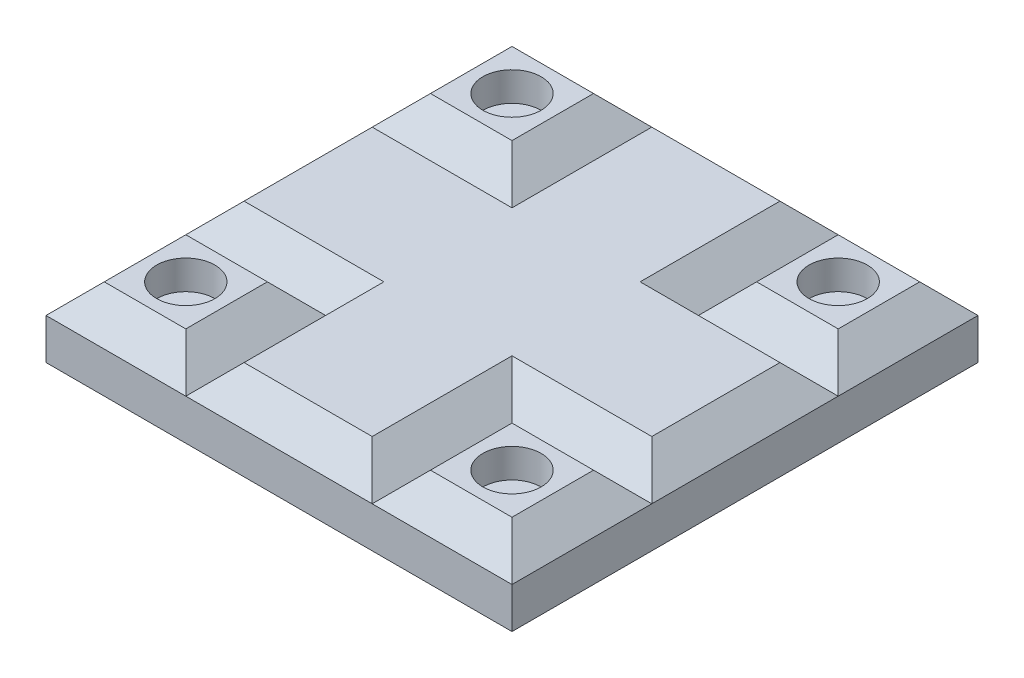
from build123d import *

# Parameters (mm, degrees)
SKETCH1_W               = 40
SKETCH1_H               = 40
BOSS_EXTRUDE1_DEPTH     = 6
SKETCH2_W               = 12
SKETCH2_H               = 12
CUT_EXTRUDE1_DEPTH      = 2.5
CHAMFER1_SIZE           = 2.5
SKETCH3_W               = 12
SKETCH3_H               = 12
BOSS_EXTRUDE2_DEPTH     = 2.5
CHAMFER2_SIZE           = 2.5
CIRPATTERN1_OUTLINE_W   = 7
CIRPATTERN1_OUTLINE_H   = 7
CIRPATTERN1_DEPTH       = 2.5
CIRPATTERN1_DRAFT       = 45
CIRPATTERN1_2_OUTLINE_W = 7
CIRPATTERN1_2_OUTLINE_H = 7
CIRPATTERN1_2_DEPTH     = 2.5
CIRPATTERN1_2_DRAFT     = 45
CIRPATTERN1_3_OUTLINE_W = 7
CIRPATTERN1_3_OUTLINE_H = 7
CIRPATTERN1_3_DEPTH     = 2.5
CIRPATTERN1_3_DRAFT     = 45
SKETCH4_R               = 2.5
CUT_EXTRUDE2_DEPTH      = 2.5
CIRPATTERN2_COUNT       = 4


# Read off the part's stored shape, not the designer's step: CirPattern1
# Some blends are built 0.0001 mm under size
with BuildPart() as part:
    # Sketch1 → Boss-Extrude1 (new body)
    with BuildSketch(Plane(origin=(0, 0, 0), x_dir=(1, 0, 0), z_dir=(0, 1, 0))):
        Rectangle(SKETCH1_W, SKETCH1_H)
    extrude(amount=BOSS_EXTRUDE1_DEPTH)

    # Sketch2 → Cut-Extrude1 (cut)
    with BuildSketch(Plane(origin=(0, 6, 0), x_dir=(1, 0, 0), z_dir=(0, 1, 0))):
        with Locations((14, 14)):
            Rectangle(SKETCH2_W, SKETCH2_H)
        with Locations((-14, 14)):
            Rectangle(SKETCH2_W, SKETCH2_H)
        with Locations((14, -14)):
            Rectangle(SKETCH2_W, SKETCH2_H)
        with Locations((-14, -14)):
            Rectangle(SKETCH2_W, SKETCH2_H)
    extrude(amount=-CUT_EXTRUDE1_DEPTH, mode=Mode.SUBTRACT)

    # Chamfer1
    chamfer1_edges = [part.edges().sort_by_distance(p)[0] for p in [
        (-20, 6, 0),
        (-14, 6, -8),
        (-8, 6, -14),
        (0, 6, -20),
        (8, 6, -14),
        (14, 6, -8),
        (20, 6, 0),
        (14, 6, 8),
        (8, 6, 14),
        (0, 6, 20),
        (-8, 6, 14),
        (-14, 6, 8),
    ]]
    chamfer(chamfer1_edges, length=CHAMFER1_SIZE - 0.0001)  # a hair under: the kernel refuses the full size

    # Sketch3 → Boss-Extrude2 (add)
    with BuildSketch(Plane(origin=(0, 3.5, 0), x_dir=(1, 0, 0), z_dir=(0, 1, 0))):
        with Locations((-14, -14)):
            Rectangle(SKETCH3_W, SKETCH3_H)
    extrude(amount=BOSS_EXTRUDE2_DEPTH)

    # Chamfer2
    # the kernel refuses this chamfer: 2.5 mm, written as the material it takes off along each edge
    with BuildSketch(Plane(origin=(-26.42920747, 6, 8), x_dir=(0, -0.9996219169112968, -0.027495876610586317), z_dir=(1, 0, 0)), Plane(origin=(-8, 6, 8), x_dir=(0.027495876610586317, -0.9996219169112968, 0), z_dir=(0, 0, 1))) as chamfer2_piece_1:
        Polygon((CHAMFER2_SIZE * 0.999621916911, -CHAMFER2_SIZE * 0.0274958766106), (-CHAMFER2_SIZE * 0.0274958766106, -CHAMFER2_SIZE * 0.999621916911), (0, 0), align=None)
    extrude(amount=18.42920747, mode=Mode.SUBTRACT)
    with BuildSketch(Plane(origin=(-1.57079253, 6, 20), x_dir=(0, -0.9996219169112968, 0.027495876610586317), z_dir=(-1, 0, 0))) as chamfer2_piece_2:
        Polygon((CHAMFER2_SIZE * 0.999621916911, -CHAMFER2_SIZE * 0.0274958766106), (-CHAMFER2_SIZE * 0.0274958766106, -CHAMFER2_SIZE * 0.999621916911), (0, 0), align=None)
    extrude(amount=24.85841494, mode=Mode.SUBTRACT)
    with BuildSketch(Plane(origin=(-20, 6, 26.42920747), x_dir=(0.9996219169112968, 0.027495876610586317, 0), z_dir=(0, 0, -1))) as chamfer2_piece_3:
        Polygon((CHAMFER2_SIZE * 0.999621916911, CHAMFER2_SIZE * 0.0274958766106), (-CHAMFER2_SIZE * 0.0274958766106, CHAMFER2_SIZE * 0.999621916911), (0, 0), align=None)
    extrude(amount=24.85841494, mode=Mode.SUBTRACT)


with BuildPart() as cirpattern1_tool:
    # CirPattern1 outline → CirPattern1 (with draft: the straight prism first)
    with BuildSketch(Plane(origin=(0, 6, 0), x_dir=(1, 0, 0), z_dir=(0, 1, 0))):
        with Locations((14, -14)):
            Rectangle(CIRPATTERN1_OUTLINE_W, CIRPATTERN1_OUTLINE_H)
    extrude(amount=-CIRPATTERN1_DEPTH)
    # CirPattern1: the draft: its side faces are tilted about the plane it starts from
    cirpattern1_sides = [cirpattern1_tool.faces().sort_by_distance(p)[0] for p in [
        (14, 4.75, 10.5),
        (10.5, 4.75, 14),
        (14, 4.75, 17.5),
        (17.5, 4.75, 14),
    ]]
    draft(cirpattern1_sides, Plane(origin=(0, 6, 0), x_dir=(1, 0, 0), z_dir=(0, 1, 0)), CIRPATTERN1_DRAFT)


with BuildPart() as part_1:
    add(part.part)

    # CirPattern1: add cirpattern1_tool
    add(cirpattern1_tool.part)


with BuildPart() as cirpattern1_2_tool:
    # CirPattern1 2 outline → CirPattern1 2 (with draft: the straight prism first)
    with BuildSketch(Plane(origin=(0, 6, 0), x_dir=(1, 0, 0), z_dir=(0, 1, 0))):
        with Locations((14, 14)):
            Rectangle(CIRPATTERN1_2_OUTLINE_W, CIRPATTERN1_2_OUTLINE_H)
    extrude(amount=-CIRPATTERN1_2_DEPTH)
    # CirPattern1 2: the draft: its side faces are tilted about the plane it starts from
    cirpattern1_2_sides = [cirpattern1_2_tool.faces().sort_by_distance(p)[0] for p in [
        (10.5, 4.75, -14),
        (14, 4.75, -10.5),
        (17.5, 4.75, -14),
        (14, 4.75, -17.5),
    ]]
    draft(cirpattern1_2_sides, Plane(origin=(0, 6, 0), x_dir=(1, 0, 0), z_dir=(0, 1, 0)), CIRPATTERN1_2_DRAFT)


with BuildPart() as part_2:
    add(part_1.part)

    # CirPattern1 2: add cirpattern1_2_tool
    add(cirpattern1_2_tool.part)


with BuildPart() as cirpattern1_3_tool:
    # CirPattern1 3 outline → CirPattern1 3 (with draft: the straight prism first)
    with BuildSketch(Plane(origin=(0, 6, 0), x_dir=(1, 0, 0), z_dir=(0, 1, 0))):
        with Locations((-14, 14)):
            Rectangle(CIRPATTERN1_3_OUTLINE_W, CIRPATTERN1_3_OUTLINE_H)
    extrude(amount=-CIRPATTERN1_3_DEPTH)
    # CirPattern1 3: the draft: its side faces are tilted about the plane it starts from
    cirpattern1_3_sides = [cirpattern1_3_tool.faces().sort_by_distance(p)[0] for p in [
        (-14, 4.75, -10.5),
        (-10.5, 4.75, -14),
        (-14, 4.75, -17.5),
        (-17.5, 4.75, -14),
    ]]
    draft(cirpattern1_3_sides, Plane(origin=(0, 6, 0), x_dir=(1, 0, 0), z_dir=(0, 1, 0)), CIRPATTERN1_3_DRAFT)


with BuildPart() as part_3:
    add(part_2.part)

    # CirPattern1 3: add cirpattern1_3_tool
    add(cirpattern1_3_tool.part)

    # Sketch4 → Cut-Extrude2 (cut)
    with BuildSketch(Plane(origin=(0, 6, 0), x_dir=(1, 0, 0), z_dir=(0, 1, 0))):
        with Locations(Location((-14, -14, 0), (0, 0, 270))):
            Circle(SKETCH4_R)
    cut_extrude2 = extrude(amount=-CUT_EXTRUDE2_DEPTH, mode=Mode.SUBTRACT)

    # CirPattern2: Cut-Extrude2 ×4 about axis
    cirpattern2_axis = Axis((0, 0, 0), (0, 1, 0))
    for i in range(1, CIRPATTERN2_COUNT):
        add(cut_extrude2.rotate(cirpattern2_axis, i * 360 / CIRPATTERN2_COUNT), mode=Mode.SUBTRACT)


solid = part_3.part
